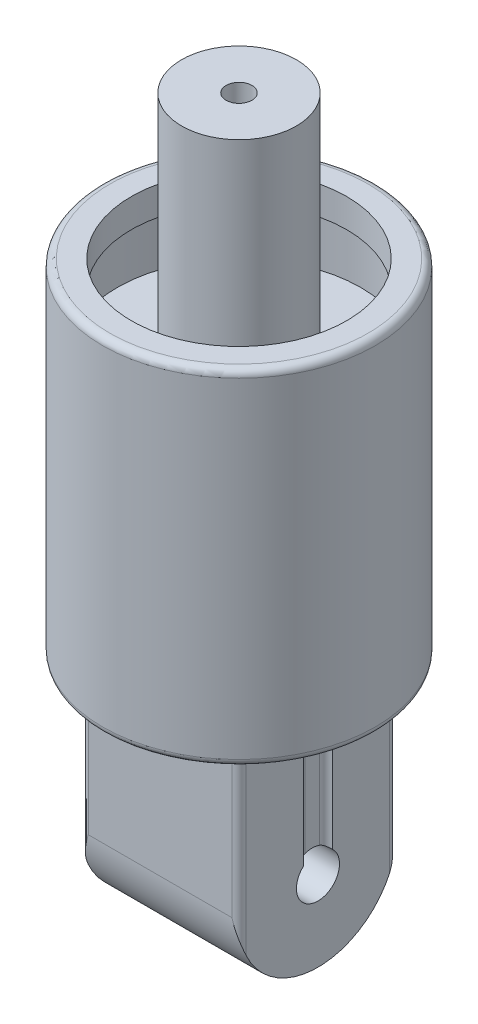
from build123d import *

# Parameters (mm, degrees)
BOSS_EXTRU_2_START      = 8
ESQUISSE4_R             = 1
BOSS_EXTRU_2_DEPTH      = 8
ENL_V_MAT_EXTRU_1_DEPTH = 20.178438414
ENL_V_MAT_EXTRU_2_REACH = 21.178
ESQUISSE6_W             = 2
ESQUISSE6_H             = 5.5
CONG_1_R                = 0.25
ESQUISSE7_W             = 1
ESQUISSE7_H             = 4.690983006
ENL_V_MAT_EXTRU_3_DEPTH = 0.2
CONG_2_R                = 0.25
CONG_2_OF_SYM_TRIE1_R   = 0.25


with BuildPart() as part:
    # Esquisse1 → Révolution1 (revolve)
    with BuildSketch(Plane.XY, mode=Mode.PRIVATE) as r_volution1_sk:
        with BuildLine():
            Line((2, 9), (2, 17))
            Line((2, 17), (0.45, 17))
            Line((0.45, 17), (0.45, 12))
            Line((0.45, 12), (1, 12))
            Line((1, 12), (1, 0))
            Line((1, 0), (4.5, 0))
            ThreePointArc((4.5, 0), (4.676776695, 0.073223305), (4.75, 0.25))
            Line((4.75, 0.25), (4.75, 11.75))
            ThreePointArc((4.75, 11.75), (4.676776695, 11.926776695), (4.5, 12))
            Line((4.5, 12), (3.75, 12))
            Line((3.75, 12), (3.75, 11))
            Line((3.75, 11), (4.25, 11))
            Line((4.25, 11), (4.25, 9))
            Line((4.25, 9), (2, 9))
        make_face()
    revolve(r_volution1_sk.sketch.rotate(Axis((0, 0, 0), (0, 1, 0)), 90), axis=Axis((0, 0, 0), (0, 1, 0)))

    # Esquisse4 → Boss.-Extru.2 (add)
    with BuildSketch(Plane.XZ.offset(BOSS_EXTRU_2_START)):
        with BuildLine():
            Line((-2.5, -2.75), (2.5, -2.75))
            ThreePointArc((2.5, -2.75), (2.676776695, -2.676776695), (2.75, -2.5))
            Line((2.75, -2.5), (2.75, 2.5))
            ThreePointArc((2.75, 2.5), (2.676776695, 2.676776695), (2.5, 2.75))
            Line((2.5, 2.75), (-2.5, 2.75))
            ThreePointArc((-2.5, 2.75), (-2.676776695, 2.676776695), (-2.75, 2.5))
            Line((-2.75, 2.5), (-2.75, -2.5))
            ThreePointArc((-2.75, -2.5), (-2.676776695, -2.676776695), (-2.5, -2.75))
        make_face()
        with Locations(Location((0, 0, 0), (0, 0, 270))):
            Circle(ESQUISSE4_R, mode=Mode.SUBTRACT)
    extrude(amount=-BOSS_EXTRU_2_DEPTH)

    # Esquisse5 → Enlèv. mat.-Extru.1 (cut, through all)
    with BuildSketch(Plane(origin=(2.75, 0, 0), x_dir=(0, 0, -1), z_dir=(1, 0, 0))):
        with BuildLine():
            Line((-2.5, -8), (0, -8))
            ThreePointArc((0, -8), (-1.48525742, -7.564413618), (-2.5, -6.395643924))
            Line((-2.5, -6.395643924), (-2.5, -8))
        make_face()
        with BuildLine():
            Line((2.5, -8), (2.5, -6.395643924))
            ThreePointArc((2.5, -6.395643924), (1.48525742, -7.564413618), (0, -8))
            Line((0, -8), (2.5, -8))
        make_face()
        with BuildLine():
            Line((-2.75, -8), (-2.5, -8))
            Line((-2.5, -8), (-2.5, -6.395643924))
            ThreePointArc((-2.5, -6.395643924), (-2.686773158, -5.83630197), (-2.75, -5.25))
            Line((-2.75, -5.25), (-2.75, -8))
        make_face()
        with BuildLine():
            Line((2.75, -8), (2.75, -5.25))
            ThreePointArc((2.75, -5.25), (2.686773158, -5.83630197), (2.5, -6.395643924))
            Line((2.5, -6.395643924), (2.5, -8))
            Line((2.5, -8), (2.75, -8))
        make_face()
        with BuildLine():
            ThreePointArc((-0.75, -5.25), (0, -6), (0.75, -5.25))
            Line((0.75, -5.25), (-0.75, -5.25))
        make_face()
        with BuildLine():
            Line((-0.75, -5.25), (0.75, -5.25))
            ThreePointArc((0.75, -5.25), (0, -4.5), (-0.75, -5.25))
        make_face()
    extrude(amount=-ENL_V_MAT_EXTRU_1_DEPTH, mode=Mode.SUBTRACT)

    # Esquisse6 → Enlèv. mat.-Extru.2 (cut, up to next)
    with BuildSketch(Plane.XY.offset(-2.75), mode=Mode.PRIVATE) as enl_v_mat_extru_2_sk1:
        with Locations((0, -5.25)):
            Rectangle(ESQUISSE6_W, ESQUISSE6_H)
    enl_v_mat_extru_2_tool1 = extrude(enl_v_mat_extru_2_sk1.sketch, amount=ENL_V_MAT_EXTRU_2_REACH, mode=Mode.PRIVATE) & part.part
    add(enl_v_mat_extru_2_tool1.solids().sort_by_distance((0, -5.25, -2.75))[0], mode=Mode.SUBTRACT)

    # Congé1
    cong_1_edges = [part.edges().sort_by_distance(p)[0] for p in [
        (1, -7.194543649, -1.944543647),
        (-1, -7.194543648, -1.944543648),
        (-1, -3.875, -2.75),
        (0, -2.5, -2.75),
        (1, -3.875, -2.75),
        (0, -7.811737691, 1),
    ]]
    fillet(cong_1_edges, radius=CONG_1_R)

    # Esquisse7 → Enlèv. mat.-Extru.3 (cut)
    with BuildSketch(Plane.ZY.offset(2.75)):
        with Locations((0, -2.345491503)):
            Rectangle(ESQUISSE7_W, ESQUISSE7_H)
    enl_v_mat_extru_3 = extrude(amount=-ENL_V_MAT_EXTRU_3_DEPTH, mode=Mode.SUBTRACT)

    # Congé2
    # the kernel refuses this fillet: 0.25 mm, written as the material it adds along each edge
    with BuildSketch(Plane(origin=(-2.55, -5.303355441, 0.5), x_dir=(-1.0, 0, -1.569855356819468e-12), z_dir=(0, 1, 0))) as cong_2_piece_1_section:
        with BuildLine():
            CenterArc((0.25, -0.244948974), CONG_2_R, 101.536959033, 78.463040967)
            Line((0, -0.244948974), (-0.005, -0.244948974))
            Line((-0.005, -0.244948974), (-0.005, 0))
            Line((-0.005, 0), (0, 0.005))
            ThreePointArc((0, 0.005), (0.1, 0.005), (0.199, 0.004898979))
            Line((0.199, 0.004898979), (0.2, 0))
        make_face()
    cong_2_piece_1 = extrude(amount=5.915727877, mode=Mode.PRIVATE)
    cong_2_piece_1 = cong_2_piece_1 - Plane(origin=(-2.600107301, -5.25, 0), x_dir=(0, 0, 1), z_dir=(1, 0, 0)) * Cylinder(0.75, 13, mode=Mode.PRIVATE)
    add(cong_2_piece_1)
    with BuildSketch(Plane(origin=(-2.55, 0.612372436, -0.5), x_dir=(-1.0, 0, 1.569855356819468e-12), z_dir=(0, -1, 0))) as cong_2_piece_2_section:
        with BuildLine():
            CenterArc((0.25, -0.244948974), CONG_2_R, 101.536959033, 78.463040967)
            Line((0, -0.244948974), (-0.005, -0.244948974))
            Line((-0.005, -0.244948974), (-0.005, 0))
            Line((-0.005, 0), (0, 0.005))
            ThreePointArc((0, 0.005), (0.1, 0.005), (0.199, 0.004898979))
            Line((0.199, 0.004898979), (0.2, 0))
        make_face()
    cong_2_piece_2 = extrude(amount=5.915727877, mode=Mode.PRIVATE)
    cong_2_piece_2 = cong_2_piece_2 - Plane(origin=(-2.599890025, -5.25, 0), x_dir=(0, 0, 1), z_dir=(1, 0, 0)) * Cylinder(0.75, 13, mode=Mode.PRIVATE)
    add(cong_2_piece_2)

    # Symétrie1: Enlèv. mat.-Extru.3 across plane
    add(enl_v_mat_extru_3.mirror(Plane(origin=(0, 0, 0), x_dir=(0, 0, 1), z_dir=(1, 0, 0))), mode=Mode.SUBTRACT)

    # Congé2 of Symétrie1
    # the kernel refuses this fillet: 0.25 mm, written as the material it adds along each edge
    with BuildSketch(Plane(origin=(2.55, -5.303355441, 0.5), x_dir=(0, 0, -1), z_dir=(0, 1, 0))) as cong_2_of_sym_trie1_piece_1_section:
        with BuildLine():
            CenterArc((0.244948974, -0.25), CONG_2_OF_SYM_TRIE1_R, 90, 78.463040967)
            Line((0, -0.2), (-0.004898979, -0.199))
            ThreePointArc((-0.004898979, -0.199), (-0.005, -0.1), (-0.005, 0))
            Line((-0.005, 0), (0, 0.005))
            Line((0, 0.005), (0.244948974, 0.005))
            Line((0.244948974, 0.005), (0.244948974, 0))
        make_face()
    cong_2_of_sym_trie1_piece_1 = extrude(amount=5.915727877, mode=Mode.PRIVATE)
    cong_2_of_sym_trie1_piece_1 = cong_2_of_sym_trie1_piece_1 - Plane(origin=(2.600107302, -5.25, 0), x_dir=(0, 0, 1), z_dir=(1, 0, 0)) * Cylinder(0.75, 13, mode=Mode.PRIVATE)
    add(cong_2_of_sym_trie1_piece_1)
    with BuildSketch(Plane(origin=(2.55, 0.612372436, -0.5), x_dir=(1.0, 0, 1.569855356819468e-12), z_dir=(0, -1, 0))) as cong_2_of_sym_trie1_piece_2_section:
        with BuildLine():
            CenterArc((0.25, 0.244948974), CONG_2_OF_SYM_TRIE1_R, 180, 78.463040967)
            Line((0, 0.244948974), (-0.005, 0.244948974))
            Line((-0.005, 0.244948974), (-0.005, 0))
            Line((-0.005, 0), (0, -0.005))
            ThreePointArc((0, -0.005), (0.1, -0.005), (0.199, -0.004898979))
            Line((0.199, -0.004898979), (0.2, 0))
        make_face()
    cong_2_of_sym_trie1_piece_2 = extrude(amount=5.915727877, mode=Mode.PRIVATE)
    cong_2_of_sym_trie1_piece_2 = cong_2_of_sym_trie1_piece_2 - Plane(origin=(2.599890025, -5.25, 0), x_dir=(0, 0, 1), z_dir=(1, 0, 0)) * Cylinder(0.75, 13, mode=Mode.PRIVATE)
    add(cong_2_of_sym_trie1_piece_2)


solid = part.part
